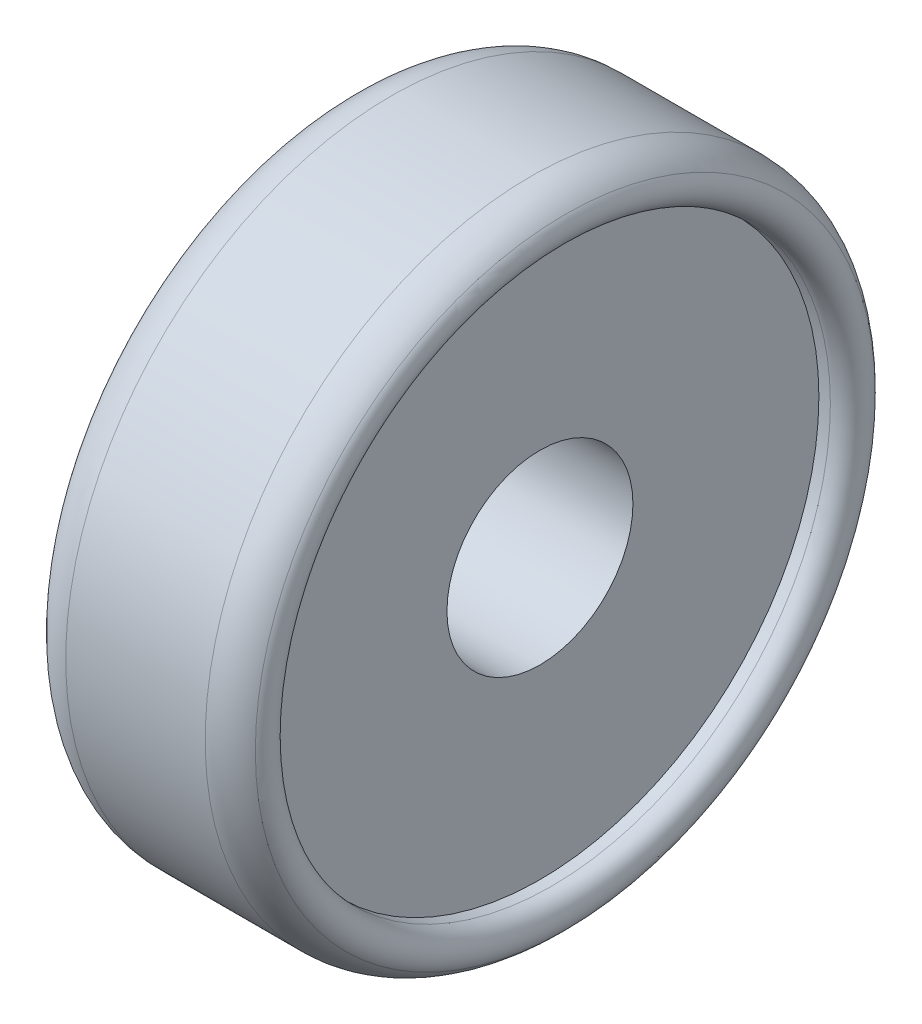
from build123d import *

# Parameters (mm, degrees)
SKETCH1_R           = 350
SKETCH1_R_2         = 100
BOSS_EXTRUDE1_DEPTH = 125
FILLET1_R           = 50
FILLET2_R           = 50
SKETCH2_R           = 300
CUT_EXTRUDE1_DEPTH  = 40
CUT_EXTRUDE2_START  = -40
SKETCH4_R           = 300
CUT_EXTRUDE2_DEPTH  = 40
FILLET3_R           = 20
FILLET4_R           = 20


with BuildPart() as part:
    # Sketch1 → Boss-Extrude1 (new, symmetric)
    with BuildSketch(Plane(origin=(0, 0, 0), x_dir=(0, 0, -1), z_dir=(1, 0, 0))):
        Circle(SKETCH1_R)
        Circle(SKETCH1_R_2, mode=Mode.SUBTRACT)
    extrude(amount=BOSS_EXTRUDE1_DEPTH, both=True)

    # Fillet1
    fillet1_edges = [part.edges().sort_by_distance(p)[0] for p in [
        (-125, 0, 350),
    ]]
    fillet(fillet1_edges, radius=FILLET1_R)

    # Fillet2
    fillet2_edges = [part.edges().sort_by_distance(p)[0] for p in [
        (125, 0, 350),
    ]]
    fillet(fillet2_edges, radius=FILLET2_R)

    # Sketch2 → Cut-Extrude1 (cut)
    with BuildSketch(Plane.ZY.offset(125)):
        Circle(SKETCH2_R)
    extrude(amount=-CUT_EXTRUDE1_DEPTH, mode=Mode.SUBTRACT)

    # Sketch4 → Cut-Extrude2 (cut)
    with BuildSketch(Plane(origin=(125, 0, 0), x_dir=(0, 0, -1), z_dir=(1, 0, 0)).offset(CUT_EXTRUDE2_START)):
        with Locations(Location((0, 0, 0), (0, 0, 180))):
            Circle(SKETCH4_R)
    extrude(amount=CUT_EXTRUDE2_DEPTH, mode=Mode.SUBTRACT)

    # Fillet3
    # the kernel refuses this fillet: 20 mm, written as the material it takes off along each edge
    with BuildSketch(Plane(origin=(125, 0, 0), x_dir=(0, 0, -1), z_dir=(0, -1, 0))) as fillet3_piece_1:
        with BuildLine():
            CenterArc((320, -27.639320225), FILLET3_R, 48.189685104, 131.810314896)
            Line((300, -27.639320225), (300, 0))
            ThreePointArc((300, 0), (317.841104489, -3.291382052), (333.333333333, -12.732200375))
        make_face()
    fillet3_piece_1_solid = revolve(axis=Axis((125, 0, 0), (1, 0, 0)), revolution_arc=180, mode=Mode.PRIVATE)
    with BuildSketch(Plane(origin=(125, 0, 0), x_dir=(0, 0, 1), z_dir=(0, 1, 0))) as fillet3_piece_2:
        with BuildLine():
            CenterArc((320, -27.639320225), FILLET3_R, 48.189685104, 131.810314896)
            Line((300, -27.639320225), (300, 0))
            ThreePointArc((300, 0), (317.841104489, -3.291382052), (333.333333333, -12.732200375))
        make_face()
    fillet3_piece_2_solid = revolve(axis=Axis((125, 0, 0), (1, 0, 0)), revolution_arc=180, mode=Mode.PRIVATE)
    add([fillet3_piece_1_solid, fillet3_piece_2_solid], mode=Mode.SUBTRACT)

    # Fillet4
    # the kernel refuses this fillet: 20 mm, written as the material it takes off along each edge
    with BuildSketch(Plane(origin=(-125, 0, 0), x_dir=(0, 0, -1), z_dir=(0, -1, 0))) as fillet4_piece_1:
        with BuildLine():
            CenterArc((320, 27.639320225), FILLET4_R, 180, 131.810314896)
            Line((300, 27.639320225), (300, 0))
            ThreePointArc((300, 0), (317.841104489, 3.291382052), (333.333333333, 12.732200375))
        make_face()
    fillet4_piece_1_solid = revolve(axis=Axis((-125, 0, 0), (1, 0, 0)), revolution_arc=180, mode=Mode.PRIVATE)
    with BuildSketch(Plane(origin=(-125, 0, 0), x_dir=(0, 0, 1), z_dir=(0, 1, 0))) as fillet4_piece_2:
        with BuildLine():
            CenterArc((320, 27.639320225), FILLET4_R, 180, 131.810314896)
            Line((300, 27.639320225), (300, 0))
            ThreePointArc((300, 0), (317.841104489, 3.291382052), (333.333333333, 12.732200375))
        make_face()
    fillet4_piece_2_solid = revolve(axis=Axis((-125, 0, 0), (1, 0, 0)), revolution_arc=180, mode=Mode.PRIVATE)
    add([fillet4_piece_1_solid, fillet4_piece_2_solid], mode=Mode.SUBTRACT)


solid = part.part
